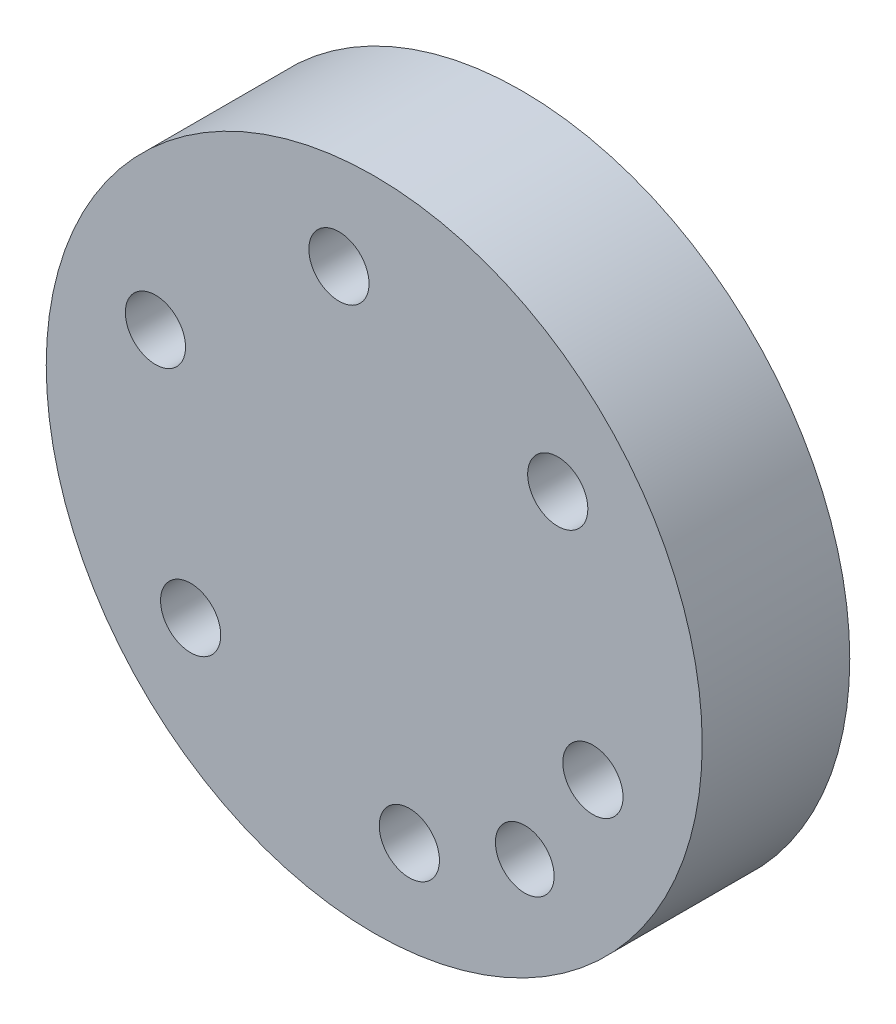
from build123d import *

# Parameters (mm, degrees)
SKETCH2_R           = 88.7
BOSS_EXTRUDE1_DEPTH = 24.9
BOSS_EXTRUDE2_START = 15
SKETCH3_R           = 88.7
SKETCH3_R_2         = 7.9375
SKETCH3_R_3         = 8.1375
BOSS_EXTRUDE2_DEPTH = 15
FILLET1_R           = 2
FILLET2_R           = 3
FILLET3_R           = 2
SKETCH4_R           = 76.8
SKETCH4_R_2         = 8.1375
SKETCH4_R_3         = 7.9375
BOSS_EXTRUDE3_DEPTH = 16.3


with BuildPart() as part:
    # Sketch2 → Boss-Extrude1 (new body)
    with BuildSketch(Plane.XY):
        with Locations((22.380830856, 278.150413141)):
            Circle(SKETCH2_R)
        with BuildLine():
            ThreePointArc((22.380830856, 354.550413141), (-54.019169144, 278.150413141), (22.380830856, 201.750413141))
            ThreePointArc((22.380830856, 201.750413141), (98.780830856, 278.150413141), (22.380830856, 354.550413141))
        make_face(mode=Mode.SUBTRACT)
    extrude(amount=-BOSS_EXTRUDE1_DEPTH)

    # Sketch3 → Boss-Extrude2 (add)
    with BuildSketch(Plane.XY.offset(BOSS_EXTRUDE2_START)):
        with Locations((22.380830856, 278.150413141)):
            Circle(SKETCH3_R)
        with Locations((63.088370199, 227.165480073)):
            Circle(SKETCH3_R_2, mode=Mode.SUBTRACT)
        with Locations((12.834949907, 340.867975839)):
            Circle(SKETCH3_R_3, mode=Mode.SUBTRACT)
        with Locations((72.010243633, 317.73432135)):
            Circle(SKETCH3_R_3, mode=Mode.SUBTRACT)
        with Locations((-36.784620153, 301.21805109)):
            Circle(SKETCH3_R_3, mode=Mode.SUBTRACT)
        with Locations((-27.264784017, 238.487003795)):
            Circle(SKETCH3_R_3, mode=Mode.SUBTRACT)
        with Locations((31.880563493, 215.334967411)):
            Circle(SKETCH3_R_3, mode=Mode.SUBTRACT)
        with Locations((81.519347087, 254.971228106)):
            Circle(SKETCH3_R_3, mode=Mode.SUBTRACT)
    extrude(amount=-BOSS_EXTRUDE2_DEPTH)

    # Fillet1
    fillet1_edges = [part.edges().sort_by_distance(p)[0] for p in [
        (55.150870199, 227.165480073, 0),
    ]]
    fillet(fillet1_edges, radius=FILLET1_R)

    # Chamfer1: read off the stored shape, not the designer's step
    # Chamfer1 outline → Chamfer1 (revolve, cut)
    with BuildSketch(Plane(origin=(22.380830856, 278.150413141, 0), x_dir=(1, 0, 0), z_dir=(0, -1, 0))):
        Polygon((80.9, -24.9), (76.4, -16.9), (76.4, -24.9), align=None)
    revolve(axis=Axis((22.380830856, 278.150413141, 0), (0, 0, 1)), mode=Mode.SUBTRACT)

    # Fillet2
    fillet2_edges = [part.edges().sort_by_distance(p)[0] for p in [
        (76.403788939, 332.173371224, -16.9),
    ]]
    fillet(fillet2_edges, radius=FILLET2_R)

    # Fillet3
    fillet3_edges = [part.edges().sort_by_distance(p)[0] for p in [
        (-58.519169144, 278.150413141, -24.9),
    ]]
    fillet(fillet3_edges, radius=FILLET3_R)


with BuildPart() as body_2:
    # Sketch4 → Boss-Extrude3 (new body)
    with BuildSketch(Plane(origin=(0, 0, 0), x_dir=(-1, 0, 0), z_dir=(0, 0, -1))):
        with Locations(Location((-22.380830856, 278.150413141, 0), (0, 0, 180))):
            Circle(SKETCH4_R)
        with Locations(Location((27.264784017, 238.487003795, 0), (0, 0, 180))):
            Circle(SKETCH4_R_2, mode=Mode.SUBTRACT)
        with Locations(Location((-31.880563493, 215.334967411, 0), (0, 0, 180))):
            Circle(SKETCH4_R_2, mode=Mode.SUBTRACT)
        with Locations(Location((-63.088370199, 227.165480073, 0), (0, 0, 180))):
            Circle(SKETCH4_R_3, mode=Mode.SUBTRACT)
        with Locations(Location((-81.519347087, 254.971228106, 0), (0, 0, 180))):
            Circle(SKETCH4_R_2, mode=Mode.SUBTRACT)
        with Locations(Location((36.784620153, 301.21805109, 0), (0, 0, 180))):
            Circle(SKETCH4_R_2, mode=Mode.SUBTRACT)
        with Locations(Location((-12.834949907, 340.867975839, 0), (0, 0, 180))):
            Circle(SKETCH4_R_2, mode=Mode.SUBTRACT)
        with Locations(Location((-72.010243633, 317.73432135, 0), (0, 0, 180))):
            Circle(SKETCH4_R_2, mode=Mode.SUBTRACT)
    extrude(amount=BOSS_EXTRUDE3_DEPTH)


solid = Compound([part.part, body_2.part])
